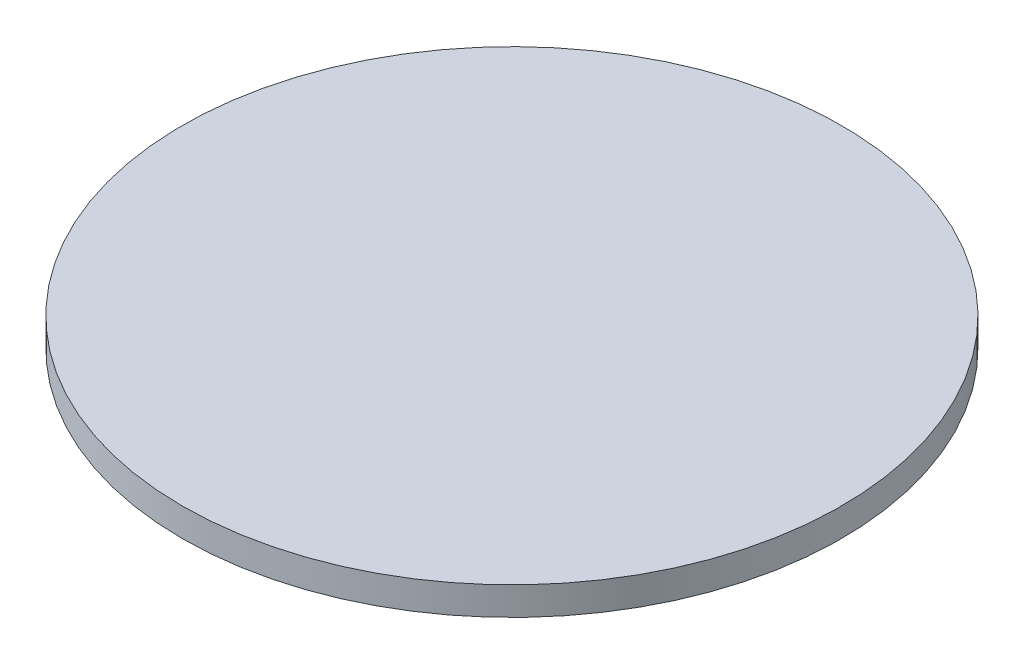
from build123d import *

# Parameters (mm, degrees)
SKETCH5_R           = 5
BOSS_EXTRUDE2_DEPTH = 5
SKETCH6_R           = 17.5
BOSS_EXTRUDE3_DEPTH = 1.5
SKETCH7_R           = 1.7
CUT_EXTRUDE1_DEPTH  = 7
FILLET1_R           = 10


with BuildPart() as part:
    # Sketch3 → Revolve1 (revolve)
    with BuildSketch(Plane.XY, mode=Mode.PRIVATE) as revolve1_sk:
        Polygon((0, 0), (2.5, 0), (5, 5), (0, 5), align=None)
    revolve(revolve1_sk.sketch.rotate(Axis((0, 0, 0), (0, 1, 0)), 90), axis=Axis((0, 0, 0), (0, 1, 0)))

    # Sketch5 → Boss-Extrude2 (add)
    with BuildSketch(Plane(origin=(0, 5, 0), x_dir=(1, 0, 0), z_dir=(0, 1, 0))):
        with Locations(Location((0, 0, 0), (0, 0, 270))):
            Circle(SKETCH5_R)
    extrude(amount=BOSS_EXTRUDE2_DEPTH)

    # Sketch6 → Boss-Extrude3 (add)
    with BuildSketch(Plane(origin=(0, 10, 0), x_dir=(1, 0, 0), z_dir=(0, 1, 0))):
        with Locations(Location((0, 0, 0), (0, 0, 270))):
            Circle(SKETCH6_R)
    extrude(amount=BOSS_EXTRUDE3_DEPTH)

    # Sketch7 → Cut-Extrude1 (cut)
    with BuildSketch(Plane.XZ):
        with Locations(Location((0, 0, 0), (0, 0, 270))):
            Circle(SKETCH7_R)
    extrude(amount=-CUT_EXTRUDE1_DEPTH, mode=Mode.SUBTRACT)

    # Fillet1
    # the kernel refuses this fillet: 10 mm, written as the material it adds along each edge
    with BuildSketch(Plane(origin=(0, 10, 0), x_dir=(0, 0, 1), z_dir=(-1, 0, 0))) as fillet1_piece_1:
        with BuildLine():
            CenterArc((13.660254038, -10), FILLET1_R, 90, 60)
            Line((5, -5), (4.826794919, -4.9))
            ThreePointArc((4.826794919, -4.9), (4.8, -2.5), (4.8, 0))
            Line((4.8, 0), (5, 0.2))
            Line((5, 0.2), (13.660254038, 0.2))
            Line((13.660254038, 0.2), (13.660254038, 0))
        make_face()
    revolve(axis=Axis((0, 10, 0), (0, 1, 0)))


solid = part.part
